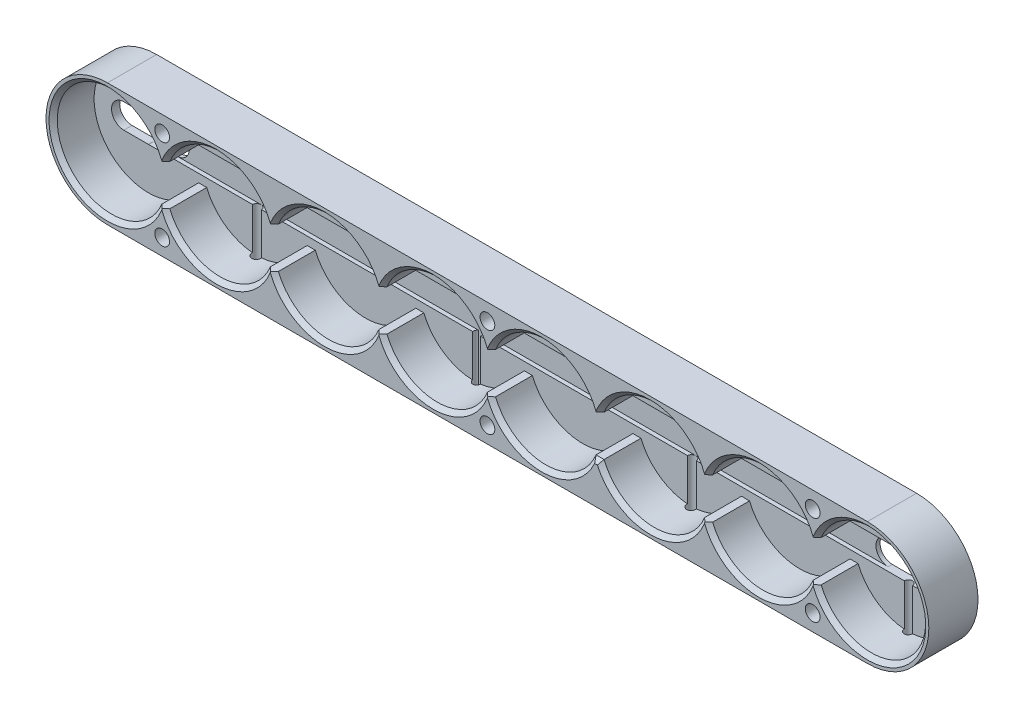
from build123d import *

# Parameters (mm, degrees)
BOSS_EXTRUDE1_DEPTH      = 10
BOSS_EXTRUDE2_START      = 2
BOSS_EXTRUDE2_DEPTH      = 2
CHAMFER4_SIZE            = 1
SKETCH5_R                = 1.8
CUT_EXTRUDE2_DEPTH       = 12
SKETCH6_R                = 2.9
CUT_EXTRUDE3_DEPTH       = 4.5
CHAMFER5_SIZE            = 1.1
CUT_EXTRUDE6_DEPTH       = 1
SKETCH10_R               = 1.128354991
SKETCH10_R_2             = 1
CUT_EXTRUDE9_DEPTH       = 13
CUT_EXTRUDE10_DEPTH      = 10
CUT_EXTRUDE10_DEPTH_BACK = 10


# Some blends are built 0.0001 mm under size
with BuildPart() as part:
    # Sketch1 → Boss-Extrude1 (new body)
    with BuildSketch(Plane.XY):
        with BuildLine():
            Line((185.5, 15), (0, 15))
            ThreePointArc((0, 15), (-15, 0), (0, -15))
            Line((0, -15), (185.5, -15))
            ThreePointArc((185.5, -15), (200.5, 0), (185.5, 15))
        make_face()
        with BuildLine():
            ThreePointArc((12.270391192, -5), (-13.25, 0), (12.270391192, 5))
            Line((12.270391192, 5), (14.229608808, 5))
            ThreePointArc((14.229608808, 5), (26.5, 13.25), (38.770391192, 5))
            Line((38.770391192, 5), (40.729608808, 5))
            ThreePointArc((40.729608808, 5), (53, 13.25), (65.270391192, 5))
            Line((65.270391192, 5), (67.229608808, 5))
            ThreePointArc((67.229608808, 5), (79.5, 13.25), (91.770391192, 5))
            Line((91.770391192, 5), (93.729608808, 5))
            ThreePointArc((93.729608808, 5), (106, 13.25), (118.270391192, 5))
            Line((118.270391192, 5), (120.229608808, 5))
            ThreePointArc((120.229608808, 5), (132.5, 13.25), (144.770391192, 5))
            Line((144.770391192, 5), (146.729608808, 5))
            ThreePointArc((146.729608808, 5), (159, 13.25), (171.270391192, 5))
            Line((171.270391192, 5), (173.229608808, 5))
            ThreePointArc((173.229608808, 5), (188.047529853, 13.002791687), (198.75, 0))
            ThreePointArc((198.75, 0), (188.047529853, -13.002791687), (173.229608808, -5))
            Line((173.229608808, -5), (171.270391192, -5))
            ThreePointArc((171.270391192, -5), (159, -13.25), (146.729608808, -5))
            Line((146.729608808, -5), (144.770391192, -5))
            ThreePointArc((144.770391192, -5), (132.5, -13.25), (120.229608808, -5))
            Line((120.229608808, -5), (118.270391192, -5))
            ThreePointArc((118.270391192, -5), (106, -13.25), (93.729608808, -5))
            Line((93.729608808, -5), (91.770391192, -5))
            ThreePointArc((91.770391192, -5), (79.5, -13.25), (67.229608808, -5))
            Line((67.229608808, -5), (65.270391192, -5))
            ThreePointArc((65.270391192, -5), (53, -13.25), (40.729608808, -5))
            Line((40.729608808, -5), (38.770391192, -5))
            ThreePointArc((38.770391192, -5), (26.5, -13.25), (14.229608808, -5))
            Line((14.229608808, -5), (12.270391192, -5))
        make_face(mode=Mode.SUBTRACT)
    extrude(amount=BOSS_EXTRUDE1_DEPTH)

    # Sketch2 → Boss-Extrude2 (add)
    with BuildSketch(Plane(origin=(0, 0, 0), x_dir=(-1, 0, 0), z_dir=(0, 0, -1)).offset(BOSS_EXTRUDE2_START)):
        with BuildLine():
            Line((0, -15), (-185.5, -15))
            ThreePointArc((-185.5, -15), (-200.5, 0), (-185.5, 15))
            Line((-185.5, 15), (0, 15))
            ThreePointArc((0, 15), (15, 0), (0, -15))
        make_face()
    extrude(amount=-BOSS_EXTRUDE2_DEPTH)

    # Chamfer4
    # the kernel refuses this chamfer: 1 mm, written as the material it takes off along each edge
    with BuildSketch(Plane(origin=(0, 0, 10), x_dir=(0.9816453862718537, -0.19071532610459777, 0), z_dir=(0.19071532610459777, 0.9816453862718537, 0))) as chamfer4_piece_1:
        Polygon((13.25 + CHAMFER4_SIZE, 0), (13.25, CHAMFER4_SIZE), (13.25, 0), align=None)
    revolve(axis=Axis((0, 0, 10), (0, 0, -1)), revolution_arc=338.010934506, mode=Mode.SUBTRACT)
    with BuildSketch(Plane(origin=(26.5, 0, 10), x_dir=(-0.9814953815696384, 0.1914858113737665, 0), z_dir=(-0.1914858113737665, -0.9814953815696384, 0))) as chamfer4_piece_2:
        Polygon((13.25 + CHAMFER4_SIZE, 0), (13.25, CHAMFER4_SIZE), (13.25, 0), align=None)
    revolve(axis=Axis((26.5, 0, 10), (0, 0, -1)), revolution_arc=157.92098568, mode=Mode.SUBTRACT)
    with BuildSketch(Plane(origin=(26.5, 0, 10), x_dir=(0.9814953815696384, -0.19148581137376705, 0), z_dir=(0.19148581137376705, 0.9814953815696384, 0))) as chamfer4_piece_3:
        Polygon((13.25 + CHAMFER4_SIZE, 0), (13.25, CHAMFER4_SIZE), (13.25, 0), align=None)
    revolve(axis=Axis((26.5, 0, 10), (0, 0, -1)), revolution_arc=157.92098568, mode=Mode.SUBTRACT)
    with BuildSketch(Plane(origin=(53, 0, 10), x_dir=(-0.9814953815696384, 0.1914858113737665, 0), z_dir=(-0.1914858113737665, -0.9814953815696384, 0))) as chamfer4_piece_4:
        Polygon((13.25 + CHAMFER4_SIZE, 0), (13.25, CHAMFER4_SIZE), (13.25, 0), align=None)
    revolve(axis=Axis((53, 0, 10), (0, 0, -1)), revolution_arc=157.92098568, mode=Mode.SUBTRACT)
    with BuildSketch(Plane(origin=(53, 0, 10), x_dir=(0.9814953815696383, -0.19148581137376733, 0), z_dir=(0.19148581137376733, 0.9814953815696383, 0))) as chamfer4_piece_5:
        Polygon((13.25 + CHAMFER4_SIZE, 0), (13.25, CHAMFER4_SIZE), (13.25, 0), align=None)
    revolve(axis=Axis((53, 0, 10), (0, 0, -1)), revolution_arc=157.92098568, mode=Mode.SUBTRACT)
    with BuildSketch(Plane(origin=(79.5, 0, 10), x_dir=(-0.9814953815696386, 0.1914858113737662, 0), z_dir=(-0.1914858113737662, -0.9814953815696386, 0))) as chamfer4_piece_6:
        Polygon((13.25 + CHAMFER4_SIZE, 0), (13.25, CHAMFER4_SIZE), (13.25, 0), align=None)
    revolve(axis=Axis((79.5, 0, 10), (0, 0, -1)), revolution_arc=157.92098568, mode=Mode.SUBTRACT)
    with BuildSketch(Plane(origin=(79.5, 0, 10), x_dir=(0.9814953815696384, -0.19148581137376663, 0), z_dir=(0.19148581137376663, 0.9814953815696384, 0))) as chamfer4_piece_7:
        Polygon((13.25 + CHAMFER4_SIZE, 0), (13.25, CHAMFER4_SIZE), (13.25, 0), align=None)
    revolve(axis=Axis((79.5, 0, 10), (0, 0, -1)), revolution_arc=157.92098568, mode=Mode.SUBTRACT)
    with BuildSketch(Plane(origin=(106, 0, 10), x_dir=(-0.9814953815696386, 0.1914858113737662, 0), z_dir=(-0.1914858113737662, -0.9814953815696386, 0))) as chamfer4_piece_8:
        Polygon((13.25 + CHAMFER4_SIZE, 0), (13.25, CHAMFER4_SIZE), (13.25, 0), align=None)
    revolve(axis=Axis((106, 0, 10), (0, 0, -1)), revolution_arc=157.92098568, mode=Mode.SUBTRACT)
    with BuildSketch(Plane(origin=(132.5, 0, 10), x_dir=(-0.9814953815696384, 0.19148581137376644, 0), z_dir=(-0.19148581137376644, -0.9814953815696384, 0))) as chamfer4_piece_9:
        Polygon((13.25 + CHAMFER4_SIZE, 0), (13.25, CHAMFER4_SIZE), (13.25, 0), align=None)
    revolve(axis=Axis((132.5, 0, 10), (0, 0, -1)), revolution_arc=157.92098568, mode=Mode.SUBTRACT)
    with BuildSketch(Plane(origin=(159, 0, 10), x_dir=(-0.9814953815696383, 0.19148581137376722, 0), z_dir=(-0.19148581137376722, -0.9814953815696383, 0))) as chamfer4_piece_10:
        Polygon((13.25 + CHAMFER4_SIZE, 0), (13.25, CHAMFER4_SIZE), (13.25, 0), align=None)
    revolve(axis=Axis((159, 0, 10), (0, 0, -1)), revolution_arc=157.92098568, mode=Mode.SUBTRACT)
    with BuildSketch(Plane(origin=(159, 0, 10), x_dir=(0.9814953815696382, -0.19148581137376783, 0), z_dir=(0.19148581137376783, 0.9814953815696382, 0))) as chamfer4_piece_11:
        Polygon((13.25 + CHAMFER4_SIZE, 0), (13.25, CHAMFER4_SIZE), (13.25, 0), align=None)
    revolve(axis=Axis((159, 0, 10), (0, 0, -1)), revolution_arc=157.92098568, mode=Mode.SUBTRACT)
    with BuildSketch(Plane(origin=(185.5, 0, 10), x_dir=(-0.9816453862718465, -0.19071532610463496, 0), z_dir=(-0.19071532610463496, 0.9816453862718465, 0))) as chamfer4_piece_12:
        Polygon((13.25 + CHAMFER4_SIZE, 0), (13.25, -CHAMFER4_SIZE), (13.25, 0), align=None)
    revolve(axis=Axis((185.5, 0, 10), (0, 0, 1)), revolution_arc=338.010934506, mode=Mode.SUBTRACT)
    with BuildSketch(Plane(origin=(106, 0, 10), x_dir=(0.9814953815696384, -0.19148581137376663, 0), z_dir=(0.19148581137376663, 0.9814953815696384, 0))) as chamfer4_piece_13:
        Polygon((13.25 + CHAMFER4_SIZE, 0), (13.25, CHAMFER4_SIZE), (13.25, 0), align=None)
    revolve(axis=Axis((106, 0, 10), (0, 0, -1)), revolution_arc=157.92098568, mode=Mode.SUBTRACT)
    with BuildSketch(Plane(origin=(132.5, 0, 10), x_dir=(0.9814953815696383, -0.19148581137376733, 0), z_dir=(0.19148581137376733, 0.9814953815696383, 0))) as chamfer4_piece_14:
        Polygon((13.25 + CHAMFER4_SIZE, 0), (13.25, CHAMFER4_SIZE), (13.25, 0), align=None)
    revolve(axis=Axis((132.5, 0, 10), (0, 0, -1)), revolution_arc=157.92098568, mode=Mode.SUBTRACT)
    with BuildSketch(Plane(origin=(122.801291796, -5, 10), x_dir=(0, -0.9996219169112968, 0.027495876610585623), z_dir=(-1, 0, 0))) as chamfer4_piece_15:
        Polygon((CHAMFER4_SIZE * 0.999621916911, -CHAMFER4_SIZE * 0.0274958766106), (-CHAMFER4_SIZE * 0.0274958766106, -CHAMFER4_SIZE * 0.999621916911), (0, 0), align=None)
    extrude(amount=7.102583592, mode=Mode.SUBTRACT)

    # Sketch5 → Cut-Extrude2 (cut)
    with BuildSketch(Plane.XY.offset(10)):
        with Locations((13.35, 11)):
            Circle(SKETCH5_R)
        with Locations((92.75, 11)):
            Circle(SKETCH5_R)
        with Locations((172.15, 11)):
            Circle(SKETCH5_R)
        with Locations((92.75, -11)):
            Circle(SKETCH5_R)
        with Locations((172.15, -11)):
            Circle(SKETCH5_R)
        with Locations((13.35, -11)):
            Circle(SKETCH5_R)
    extrude(amount=-CUT_EXTRUDE2_DEPTH, mode=Mode.SUBTRACT)

    # Sketch6 → Cut-Extrude3 (cut)
    with BuildSketch(Plane(origin=(0, 0, -2), x_dir=(-1, 0, 0), z_dir=(0, 0, -1))):
        with Locations((-13.35, 11)):
            Circle(SKETCH6_R)
        with Locations((-92.75, 11)):
            Circle(SKETCH6_R)
        with Locations((-172.15, 11)):
            Circle(SKETCH6_R)
        with Locations((-92.75, -11)):
            Circle(SKETCH6_R)
        with Locations((-172.15, -11)):
            Circle(SKETCH6_R)
        with Locations((-13.35, -11)):
            Circle(SKETCH6_R)
    extrude(amount=-CUT_EXTRUDE3_DEPTH, mode=Mode.SUBTRACT)

    # Chamfer5
    chamfer5_edges = [part.edges().sort_by_distance(p)[0] for p in [
        (16.25, -11, 2.5),
        (175.05, -11, 2.5),
        (95.65, -11, 2.5),
        (175.05, 11, 2.5),
        (95.65, 11, 2.5),
        (16.25, 11, 2.5),
    ]]
    chamfer(chamfer5_edges, length=CHAMFER5_SIZE - 0.0001)  # a hair under: the kernel refuses the full size

    # Sketch9 → Cut-Extrude6 (cut)
    with BuildSketch(Plane.XY):
        with BuildLine():
            Line((185.5, 3), (0.086805741, 3))
            ThreePointArc((0.086805741, 3), (-3.00125561, 0), (0.086805741, -3))
            Line((0.086805741, -3), (185.5, -3))
            ThreePointArc((185.5, -3), (188.5, 0), (185.5, 3))
        make_face()
    extrude(amount=-CUT_EXTRUDE6_DEPTH, mode=Mode.SUBTRACT)

    # Sketch10 → Cut-Extrude9 (cut)
    with BuildSketch(Plane.XZ.offset(15)):
        with Locations((132.662367023, 0.128354991)):
            Circle(SKETCH10_R)
        with Locations(Location((185.5, 0, 0), (0, 0, 270))):
            Circle(SKETCH10_R_2)
        with Locations((26.5, 0.128354991)):
            Circle(SKETCH10_R)
        with BuildLine():
            Line((79.611358313, -1), (80.589262077, -1))
            ThreePointArc((80.589262077, -1), (80.100310195, 0.872310757), (79.611358313, -1))
        make_face()
    extrude(amount=-CUT_EXTRUDE9_DEPTH, mode=Mode.SUBTRACT)

    # Sketch11 → Cut-Extrude10 (cut, two sides: drawn at the far end of the back side and taken through both)
    with BuildSketch(Plane.XY.offset(-1).offset(-CUT_EXTRUDE10_DEPTH_BACK)):
        with BuildLine():
            Line((-6, 3), (6, 3))
            ThreePointArc((6, 3), (9, 0), (6, -3))
            Line((6, -3), (-6, -3))
            ThreePointArc((-6, -3), (-9, 0), (-6, 3))
        make_face()
        with BuildLine():
            Line((191.586805741, -3), (179.586805741, -3))
            ThreePointArc((179.586805741, -3), (176.586805741, 0), (179.586805741, 3))
            Line((179.586805741, 3), (191.586805741, 3))
            ThreePointArc((191.586805741, 3), (194.586805741, 0), (191.586805741, -3))
        make_face()
    extrude(amount=CUT_EXTRUDE10_DEPTH + CUT_EXTRUDE10_DEPTH_BACK, mode=Mode.SUBTRACT)


solid = part.part
